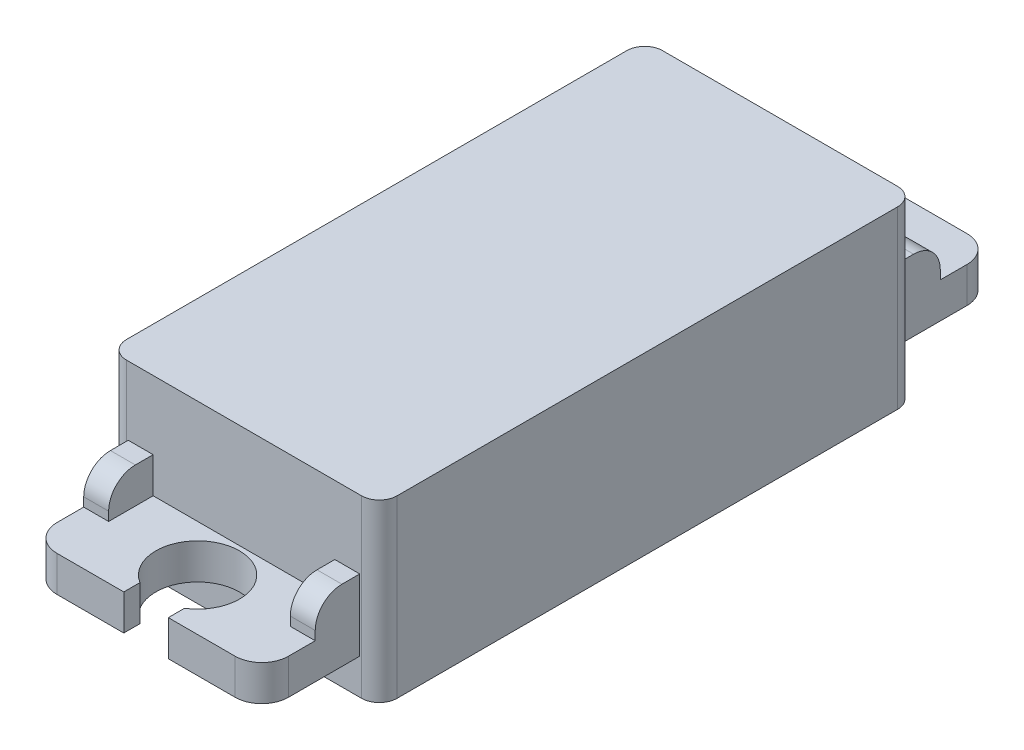
from build123d import *

# Parameters (mm, degrees)
SKETCH1_W            = 15.2
SKETCH1_H            = 30.1
BOSS_EXTRUDE1_DEPTH  = 9.85
SKETCH2_W            = 13
SKETCH2_H            = 2
BOSS_EXTRUDE2_DEPTH  = 5.5
CUT_EXTRUDE2_DEPTH   = 23.677852632
FILLET1_R            = 1.5
SKETCH4_W            = 1.4
SKETCH4_H            = 2.5
BOSS_EXTRUDE3_DEPTH  = 2
FILLET3_R            = 1.5
FILLET3_OF_MIRROR1_R = 1.5
FILLET4_R            = 1


# Read off the part's stored shape, not the designer's step: Mirror2
with BuildPart() as part:
    # Sketch1 → Boss-Extrude1 (new body)
    with BuildSketch(Plane(origin=(0, 0, 0), x_dir=(1, 0, 0), z_dir=(0, 1, 0))):
        Rectangle(SKETCH1_W, SKETCH1_H)
    extrude(amount=BOSS_EXTRUDE1_DEPTH)

    # Sketch2 → Boss-Extrude2 (add)
    with BuildSketch(Plane.XY.offset(15.05)):
        with Locations((0, 3)):
            Rectangle(SKETCH2_W, SKETCH2_H)
    extrude(amount=BOSS_EXTRUDE2_DEPTH)

    # Sketch3 → Cut-Extrude2 (cut, through all)
    with BuildSketch(Plane(origin=(0, 4, 0), x_dir=(-1, 0, 0), z_dir=(0, 1, 0))):
        with BuildLine():
            Line((-1.25, 15.663025126), (-1.25, 17.653))
            Line((-1.25, 17.653), (-1.25, 19.642974874))
            ThreePointArc((-1.25, 19.642974874), (-2.35, 17.653), (-1.25, 15.663025126))
        make_face()
        with BuildLine():
            Line((-1.25, 19.642974874), (-1.25, 17.653))
            Line((-1.25, 17.653), (1.25, 17.653))
            Line((1.25, 17.653), (1.25, 19.642974874))
            ThreePointArc((1.25, 19.642974874), (0, 20.003), (-1.25, 19.642974874))
        make_face()
        with BuildLine():
            Line((1.25, 17.653), (-1.25, 17.653))
            Line((-1.25, 17.653), (-1.25, 15.663025126))
            ThreePointArc((-1.25, 15.663025126), (0, 15.303), (1.25, 15.663025126))
            Line((1.25, 15.663025126), (1.25, 17.653))
        make_face()
        with BuildLine():
            Line((1.25, 19.642974874), (1.25, 17.653))
            Line((1.25, 17.653), (1.25, 15.663025126))
            ThreePointArc((1.25, 15.663025126), (2.05669638, 16.5161183), (2.35, 17.653))
            ThreePointArc((2.35, 17.653), (2.05669638, 18.7898817), (1.25, 19.642974874))
        make_face()
        with BuildLine():
            Line((-1.25, 20.55), (-1.25, 19.642974874))
            ThreePointArc((-1.25, 19.642974874), (0, 20.003), (1.25, 19.642974874))
            Line((1.25, 19.642974874), (1.25, 20.55))
            Line((1.25, 20.55), (-1.25, 20.55))
        make_face()
    extrude(amount=-CUT_EXTRUDE2_DEPTH, mode=Mode.SUBTRACT)

    # Fillet1
    fillet1_edges = [part.edges().sort_by_distance(p)[0] for p in [
        (6.5, 3, 20.55),
        (-6.5, 3, 20.55),
    ]]
    fillet(fillet1_edges, radius=FILLET1_R)

    # Sketch4 → Boss-Extrude3 (add)
    with BuildSketch(Plane(origin=(0, 4, 0), x_dir=(-1, 0, 0), z_dir=(0, 1, 0))):
        with Locations((5.8, 16.3)):
            Rectangle(SKETCH4_W, SKETCH4_H)
    boss_extrude3 = extrude(amount=BOSS_EXTRUDE3_DEPTH)

    # Fillet3
    fillet3_edges = [part.edges().sort_by_distance(p)[0] for p in [
        (-5.8, 6, 17.55),
    ]]
    fillet(fillet3_edges, radius=FILLET3_R)

    # Mirror1: Boss-Extrude3 across plane
    add(boss_extrude3.mirror(Plane(origin=(0, 0, 0), x_dir=(0, 0, 1), z_dir=(1, 0, 0))))

    # Fillet3 of Mirror1
    fillet3_of_mirror1_edges = [part.edges().sort_by_distance(p)[0] for p in [
        (5.8, 6, 17.55),
    ]]
    fillet(fillet3_of_mirror1_edges, radius=FILLET3_OF_MIRROR1_R)

    # Mirror2: part across plane


with BuildPart() as part_1:
    add(part.part)
    add(part.part.mirror(Plane.XY))

    # Fillet4
    fillet4_edges = [part_1.edges().sort_by_distance(p)[0] for p in [
        (-7.6, 4.925, -15.05),
        (7.6, 4.925, -15.05),
        (7.6, 4.925, 15.05),
        (-7.6, 4.925, 15.05),
    ]]
    fillet(fillet4_edges, radius=FILLET4_R)


solid = part_1.part
